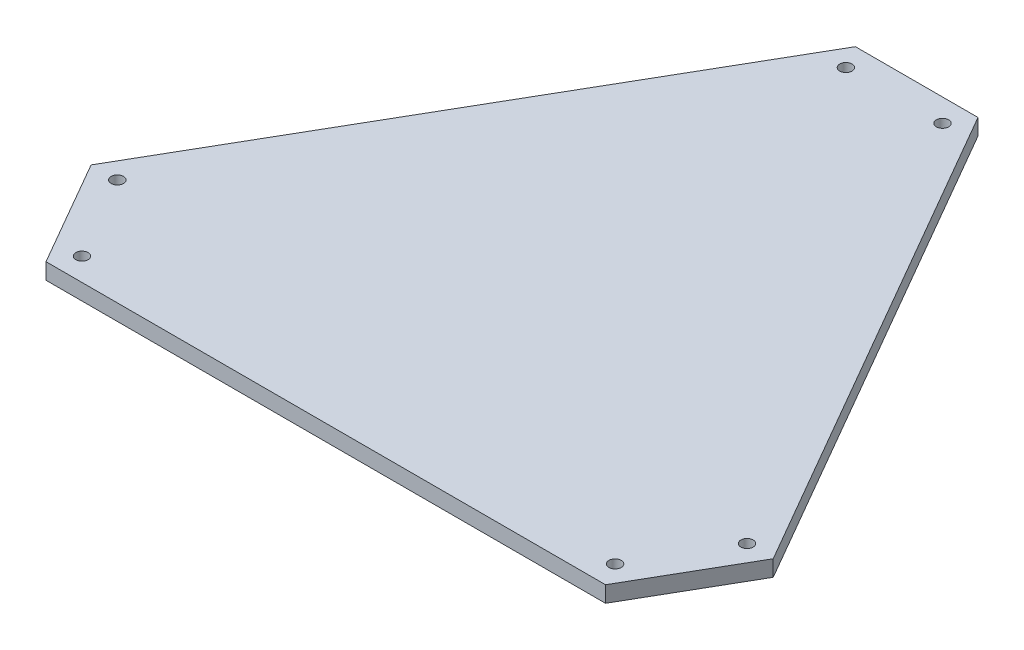
from build123d import *

# Parameters (mm, degrees)
RESSALTO_EXTRUS_O1_DEPTH = 3
CORTE_EXTRUS_O1_DEPTH    = 151.026697624
ESBO_O5_R                = 1.15
ESBO_O5_R_2              = 1.149998009
ESBO_O5_R_3              = 1.149993787
CORTE_EXTRUS_O3_DEPTH    = 128.178545465


with BuildPart() as part:
    # Esboço1 → Ressalto-extrusão1 (new body)
    with BuildSketch(Plane(origin=(0, 0, 0), x_dir=(1, 0, 0), z_dir=(0, 1, 0))):
        Polygon((-75, 0), (75, 0), (0, 129.9), align=None)
    extrude(amount=RESSALTO_EXTRUS_O1_DEPTH)

    # Esboço3 → Corte-extrusão1 (cut, through all)
    with BuildSketch(Plane(origin=(0, 3, 0), x_dir=(1, 0, 0), z_dir=(0, 1, 0))):
        Polygon((52.12820532, 0), (63.556663987, 19.819857975), (75, 0), align=None)
        Polygon((-52.141215794, 0), (-63.556663987, 19.819857975), (-75, 0), align=None)
        Polygon((-11.421585635, 110.117813679), (11.421585635, 110.117813679), (0, 129.9), align=None)
    extrude(amount=-CORTE_EXTRUS_O1_DEPTH, mode=Mode.SUBTRACT)

    # Esboço5 → Corte-extrusão3 (cut, through all)
    with BuildSketch(Plane(origin=(0, 3, 0), x_dir=(1, 0, 0), z_dir=(0, 1, 0))):
        with Locations((-49.687989721, 4.250373636)):
            Circle(ESBO_O5_R)
        with Locations((-58.687989721, 19.838830904)):
            Circle(ESBO_O5_R)
        with Locations((58.661761519, 19.83730914)):
            Circle(ESBO_O5_R)
        with Locations((49.661761519, 4.248851872)):
            Circle(ESBO_O5_R)
        with Locations((-8.943534892, 105.865797451)):
            Circle(ESBO_O5_R_2)
        with Locations((9.05637457, 105.866807251)):
            Circle(ESBO_O5_R_3)
    extrude(amount=-CORTE_EXTRUS_O3_DEPTH, mode=Mode.SUBTRACT)


solid = part.part
